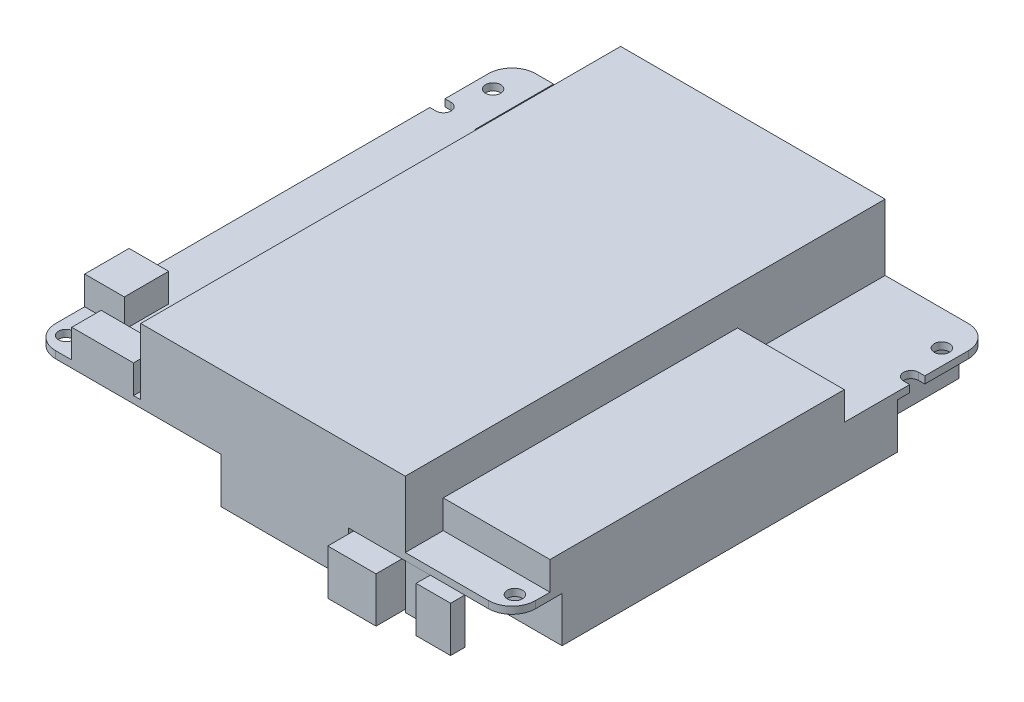
from build123d import *

# Parameters (mm, degrees)
SKETCH_1_R          = 1.6
EXTRUDE_1_DEPTH     = 1.5
SKETCH_2_W          = 56
SKETCH_2_H          = 101.6
EXTRUDE_2_DEPTH     = 14
SKETCH_3_W          = 22.6
SKETCH_3_H          = 62.30419098
SKETCH_3_W_2        = 13.073006245
SKETCH_3_H_2        = 6.218410599
SKETCH_3_W_3        = 8.391210828
SKETCH_3_H_3        = 9.399534429
EXTRUDE_3_DEPTH     = 6
SKETCH_4_W          = 6
SKETCH_4_H          = 11.3
EXTRUDE_4_DEPTH     = 13.4
SKETCH_5_W          = 1.75
SKETCH_5_H          = 8
CUT_EXTRUDE_1_DEPTH = 45
SKETCH_6_W          = 20
SKETCH_6_H          = 13
SKETCH_6_W_2        = 21
SKETCH_6_H_2        = 24
SKETCH_6_W_3        = 30
SKETCH_6_H_3        = 55
SKETCH_6_W_4        = 51
SKETCH_6_H_4        = 71
SKETCH_6_W_5        = 6.36
SKETCH_6_H_5        = 16
SKETCH_6_W_6        = 27
SKETCH_6_H_6        = 4
SKETCH_6_W_7        = 10.21
SKETCH_6_H_7        = 13.5
SKETCH_6_W_8        = 7.6
SKETCH_6_H_8        = 2.5
SKETCH_6_W_9        = 7.3
SKETCH_6_H_9        = 3
EXTRUDE_5_DEPTH     = 9.6


with BuildPart() as part:
    # Эскиз1 → Бобышка-Вытянуть1 (new body)
    with BuildSketch(Plane(origin=(0, 0, 0), x_dir=(1, 0, 0), z_dir=(0, 1, 0))):
        with BuildLine():
            Line((-41.98741166, 50.8), (-45.8, 50.8))
            ThreePointArc((-45.8, 50.8), (-49.335533906, 49.335533906), (-50.8, 45.8))
            Line((-50.8, 45.8), (-50.8, 36.6))
            Line((-50.8, 36.6), (-49.5, 36.6))
            ThreePointArc((-49.5, 36.6), (-47.9, 35), (-49.5, 33.4))
            Line((-49.5, 33.4), (-50.8, 33.4))
            Line((-50.8, 33.4), (-50.8, -45.8))
            ThreePointArc((-50.8, -45.8), (-49.335533906, -49.335533906), (-45.8, -50.8))
            Line((-45.8, -50.8), (45.8, -50.8))
            ThreePointArc((45.8, -50.8), (49.335533906, -49.335533906), (50.8, -45.8))
            Line((50.8, -45.8), (50.8, 33.4))
            Line((50.8, 33.4), (49.5, 33.4))
            ThreePointArc((49.5, 33.4), (47.9, 35), (49.5, 36.6))
            Line((49.5, 36.6), (50.8, 36.6))
            Line((50.8, 36.6), (50.8, 45.8))
            ThreePointArc((50.8, 45.8), (49.335533906, 49.335533906), (45.8, 50.8))
            Line((45.8, 50.8), (-28.760333271, 50.8))
            Line((-28.760333271, 50.8), (-28.760333271, 34.113711923))
            Line((-28.760333271, 34.113711923), (-41.98741166, 34.113711923))
            Line((-41.98741166, 34.113711923), (-41.98741166, 50.8))
        make_face()
        with Locations((-47.5, -46.9)):
            Circle(SKETCH_1_R, mode=Mode.SUBTRACT)
        with Locations((47.5, -46.9)):
            Circle(SKETCH_1_R, mode=Mode.SUBTRACT)
        with Locations((-47.5, 43.5)):
            Circle(SKETCH_1_R, mode=Mode.SUBTRACT)
        with Locations((47.5, 43.5)):
            Circle(SKETCH_1_R, mode=Mode.SUBTRACT)
    extrude(amount=EXTRUDE_1_DEPTH)

    # Эскиз2 → Бобышка-Вытянуть2 (add)
    with BuildSketch(Plane(origin=(0, 1.5, 0), x_dir=(1, 0, 0), z_dir=(0, 1, 0))):
        with Locations((0.2, 0)):
            Rectangle(SKETCH_2_W, SKETCH_2_H)
    extrude(amount=EXTRUDE_2_DEPTH)

    # Эскиз3 → Бобышка-Вытянуть3 (add)
    with BuildSketch(Plane(origin=(0, 1.5, 0), x_dir=(1, 0, 0), z_dir=(0, 1, 0))):
        with Locations((39.5, -11.607082664)):
            Rectangle(SKETCH_3_W, SKETCH_3_H)
        with Locations((-35.87228605, -47.690794701)):
            Rectangle(SKETCH_3_W_2, SKETCH_3_H_2)
        with Locations((-46.604394586, -34.970831235)):
            Rectangle(SKETCH_3_W_3, SKETCH_3_H_3)
    extrude(amount=EXTRUDE_3_DEPTH)

    # Эскиз4 → Бобышка-Вытянуть4 (add)
    with BuildSketch(Plane.XZ):
        with Locations((27.8, -45.15)):
            Rectangle(SKETCH_4_W, SKETCH_4_H)
    extrude(amount=EXTRUDE_4_DEPTH)

    # Эскиз5 → Вырез-Вытянуть1 (cut)
    with BuildSketch(Plane(origin=(0, 0, -50.8), x_dir=(-1, 0, 0), z_dir=(0, 0, -1))):
        with Locations((-26.531274607, 11.4)):
            Rectangle(SKETCH_5_W, SKETCH_5_H)
        with Locations((-24.581274607, 11.4)):
            Rectangle(SKETCH_5_W, SKETCH_5_H)
        with Locations((-22.631274607, 11.4)):
            Rectangle(SKETCH_5_W, SKETCH_5_H)
        with Locations((-20.681274607, 11.4)):
            Rectangle(SKETCH_5_W, SKETCH_5_H)
        with Locations((-18.731274607, 11.4)):
            Rectangle(SKETCH_5_W, SKETCH_5_H)
        with Locations((-16.781274607, 11.4)):
            Rectangle(SKETCH_5_W, SKETCH_5_H)
        with Locations((-14.831274607, 11.4)):
            Rectangle(SKETCH_5_W, SKETCH_5_H)
        with Locations((-12.881274607, 11.4)):
            Rectangle(SKETCH_5_W, SKETCH_5_H)
        with Locations((-10.931274607, 11.4)):
            Rectangle(SKETCH_5_W, SKETCH_5_H)
        with Locations((-8.981274607, 11.4)):
            Rectangle(SKETCH_5_W, SKETCH_5_H)
        with Locations((-7.031274607, 11.4)):
            Rectangle(SKETCH_5_W, SKETCH_5_H)
        with Locations((-5.081274607, 11.4)):
            Rectangle(SKETCH_5_W, SKETCH_5_H)
        with Locations((-3.131274607, 11.4)):
            Rectangle(SKETCH_5_W, SKETCH_5_H)
        with Locations((-1.181274607, 11.4)):
            Rectangle(SKETCH_5_W, SKETCH_5_H)
        with Locations((0.768725393, 11.4)):
            Rectangle(SKETCH_5_W, SKETCH_5_H)
        with Locations((2.718725393, 11.4)):
            Rectangle(SKETCH_5_W, SKETCH_5_H)
        with Locations((4.668725393, 11.4)):
            Rectangle(SKETCH_5_W, SKETCH_5_H)
        with Locations((6.618725393, 11.4)):
            Rectangle(SKETCH_5_W, SKETCH_5_H)
        with Locations((8.568725393, 11.4)):
            Rectangle(SKETCH_5_W, SKETCH_5_H)
        with Locations((10.518725393, 11.4)):
            Rectangle(SKETCH_5_W, SKETCH_5_H)
        with Locations((12.468725393, 11.4)):
            Rectangle(SKETCH_5_W, SKETCH_5_H)
        with Locations((14.418725393, 11.4)):
            Rectangle(SKETCH_5_W, SKETCH_5_H)
        with Locations((16.368725393, 11.4)):
            Rectangle(SKETCH_5_W, SKETCH_5_H)
        with Locations((18.318725393, 11.4)):
            Rectangle(SKETCH_5_W, SKETCH_5_H)
        with Locations((20.268725393, 11.4)):
            Rectangle(SKETCH_5_W, SKETCH_5_H)
        with Locations((22.218725393, 11.4)):
            Rectangle(SKETCH_5_W, SKETCH_5_H)
        with Locations((24.168725393, 11.4)):
            Rectangle(SKETCH_5_W, SKETCH_5_H)
        with Locations((26.118725393, 11.4)):
            Rectangle(SKETCH_5_W, SKETCH_5_H)
    extrude(amount=-CUT_EXTRUDE_1_DEPTH, mode=Mode.SUBTRACT)

    # Эскиз6 → Бобышка-Вытянуть5 (add)
    with BuildSketch(Plane.XZ):
        with Locations((33.8, -44.3)):
            Rectangle(SKETCH_6_W, SKETCH_6_H)
        with Locations((-16.3, -38.8)):
            Rectangle(SKETCH_6_W_2, SKETCH_6_H_2)
        with Locations((-35.8, 4.7)):
            Rectangle(SKETCH_6_W_3, SKETCH_6_H_3)
        with Locations((25.3, 4.7)):
            Rectangle(SKETCH_6_W_4, SKETCH_6_H_4)
        with Locations((-6.98, 32.8)):
            Rectangle(SKETCH_6_W_5, SKETCH_6_H_5)
        with Locations((2.7, 48.8)):
            Rectangle(SKETCH_6_W_6, SKETCH_6_H_6)
        with Locations((22.405, 49.55)):
            Rectangle(SKETCH_6_W_7, SKETCH_6_H_7)
        with Locations((32, 49.45)):
            Rectangle(SKETCH_6_W_8, SKETCH_6_H_8)
        with Locations((37.15, 52.3)):
            Rectangle(SKETCH_6_W_9, SKETCH_6_H_9)
    extrude(amount=EXTRUDE_5_DEPTH)


with BuildPart() as extrude_5_piece_1:
    # of the separate pieces the step leaves, piece 1, a body of its own (extrude_5_pieces)
    add(part.part.solids().sort_by_distance((45.8, 0, -50.8))[0])


with BuildPart() as extrude_5_piece_2:
    # of the separate pieces the step leaves, piece 2, a body of its own (extrude_5_pieces)
    add(part.part.solids().sort_by_distance((40.8, -9.6, 50.8))[0])


solid = Compound([extrude_5_piece_1.part, extrude_5_piece_2.part])
